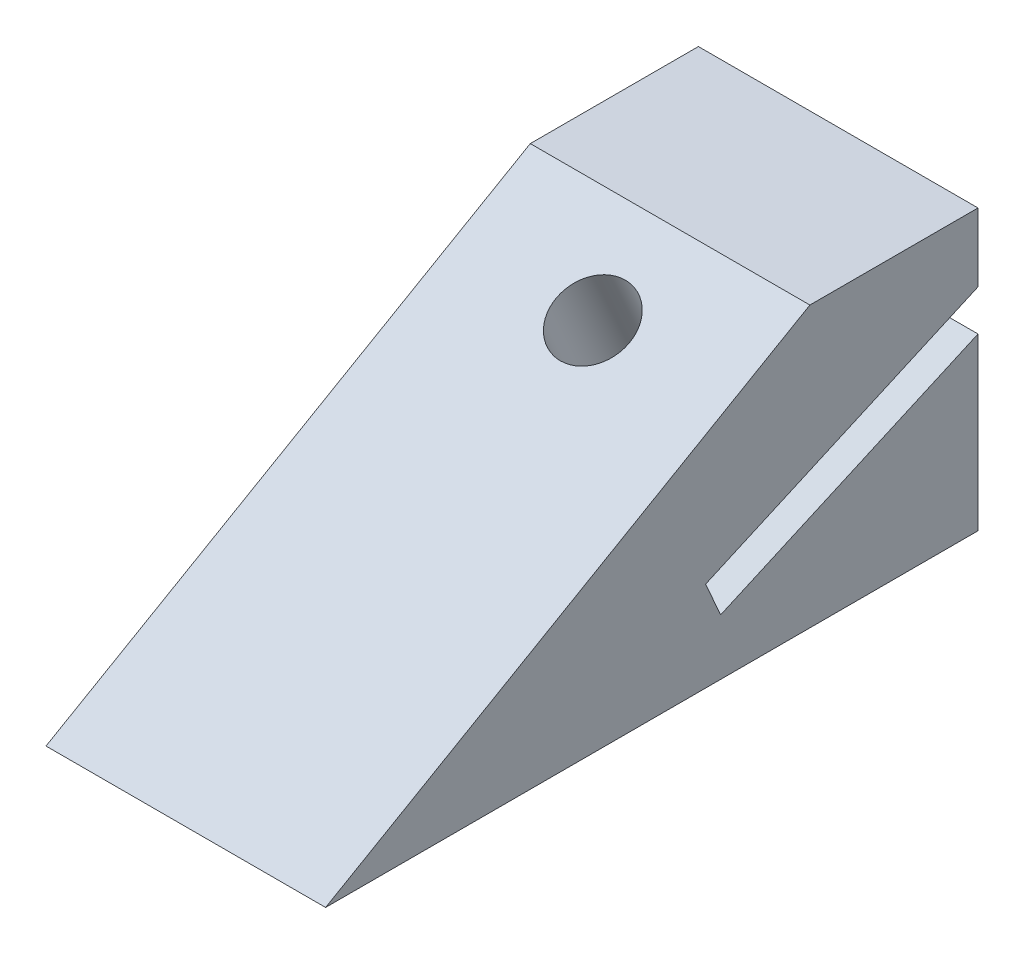
from build123d import *

# Parameters (mm, degrees)
BOSS_EXTRUDE2_DEPTH     = 15
CUT_EXTRUDE5_DEPTH      = 11
CUT_EXTRUDE5_DEPTH_BACK = 2
SKETCH7_R               = 2


with BuildPart() as part:
    # Sketch3 → Boss-Extrude2 (new body)
    with BuildSketch(Plane(origin=(0, 0, 0), x_dir=(0, 0, -1), z_dir=(1, 0, 0))):
        Polygon((25.980762114, 15), (0, 0), (35, 0), (35, 9.145604647), (21.196745964, 3), (20.383272678, 4.827090915), (35, 11.334877204), (35, 15), align=None)
    extrude(amount=BOSS_EXTRUDE2_DEPTH)

    # Sketch7 → Cut-Extrude5 (cut, two sides: drawn at the far end of the back side and taken through both)
    with BuildSketch(Plane(origin=(0, -5.37243013, -2.391960004), x_dir=(1, 0, 0), z_dir=(0, 0.9135454576426009, 0.4067366430758006)).offset(-CUT_EXTRUDE5_DEPTH_BACK)):
        with Locations((7.5, 25.075140664)):
            Circle(SKETCH7_R)
    extrude(amount=CUT_EXTRUDE5_DEPTH + CUT_EXTRUDE5_DEPTH_BACK, mode=Mode.SUBTRACT)


solid = part.part
